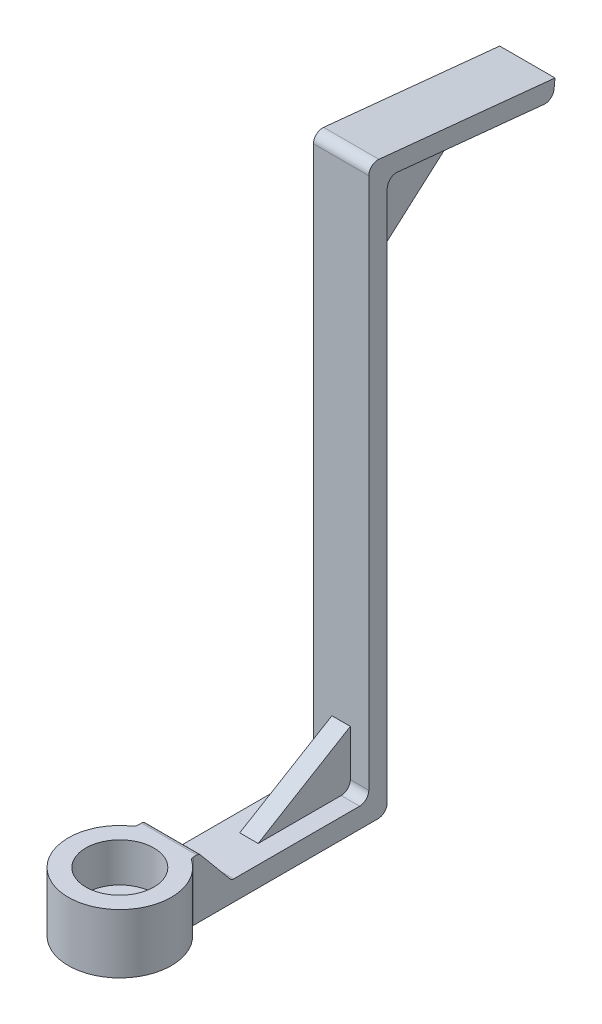
from build123d import *

# Parameters (mm, degrees)
SKETCH1_R                  = 2.794
SKETCH1_R_2                = 1.8415
BOSS_EXTRUDE1_DEPTH        = 3.2131
BOSS_EXTRUDE2_DEPTH        = 1.0922
M1_6_CLEARANCE_HOLE1_D     = 1.8
M1_6_CLEARANCE_HOLE1_DEPTH = 7.25
M1_6_CLEARANCE_HOLE1_TIP   = 0.540774557
SKETCH4_R                  = 1.651
CUT_EXTRUDE2_DEPTH         = 0.127
SKETCH5_W                  = 3
SKETCH5_H                  = 1
BOSS_EXTRUDE3_DEPTH        = 30
BOSS_EXTRUDE4_DEPTH        = 3
FILLET1_R                  = 0.5
RIB1_START                 = -0.5
RIB1_DEPTH                 = 1
RIB3_START                 = -0.5
RIB3_DEPTH                 = 1
BOSS_EXTRUDE8_DEPTH        = 1.5
FILLET2_R                  = 0.25


# Read off the part's stored shape, not the designer's step: Rib1, Rib3
with BuildPart() as part:
    # Sketch1 → Boss-Extrude1 (new body)
    with BuildSketch(Plane(origin=(0, 0, 0), x_dir=(1, 0, 0), z_dir=(0, 1, 0))):
        with Locations(Location((0, 0, 0), (0, 0, 270))):
            Circle(SKETCH1_R)
        with Locations(Location((0, 0, 0), (0, 0, 270))):
            Circle(SKETCH1_R_2, mode=Mode.SUBTRACT)
    extrude(amount=BOSS_EXTRUDE1_DEPTH)

    # Sketch2 → Boss-Extrude2 (add)
    with BuildSketch(Plane(origin=(0, 0, 0), x_dir=(1, 0, 0), z_dir=(0, 1, 0))):
        with BuildLine():
            Line((-1.5, 6.604), (-1.5, 2.357209367))
            ThreePointArc((-1.5, 2.357209367), (0, -2.794), (1.5, 2.357209367))
            Line((1.5, 2.357209367), (1.5, 6.604))
            Line((1.5, 6.604), (1.5, 13))
            Line((1.5, 13), (-1.5, 13))
            Line((-1.5, 13), (-1.5, 6.604))
        make_face()
    extrude(amount=BOSS_EXTRUDE2_DEPTH)

    # M1.6 Clearance Hole1
    with Locations(Plane(origin=(0, 1.0922, 0), x_dir=(1, 0, 0), z_dir=(0, 1, 0))):
        with Locations((0, 0)):
            Hole(M1_6_CLEARANCE_HOLE1_D / 2, depth=M1_6_CLEARANCE_HOLE1_DEPTH)
            with Locations((0, 0, -(M1_6_CLEARANCE_HOLE1_DEPTH + M1_6_CLEARANCE_HOLE1_TIP / 2))):  # 118° drill point
                Cone(0, M1_6_CLEARANCE_HOLE1_D / 2, M1_6_CLEARANCE_HOLE1_TIP, mode=Mode.SUBTRACT)

    # Sketch4 → Cut-Extrude2 (cut)
    with BuildSketch(Plane.XZ):
        with Locations(Location((0, 0, 0), (0, 0, 270))):
            Circle(SKETCH4_R)
    extrude(amount=-CUT_EXTRUDE2_DEPTH, mode=Mode.SUBTRACT)

    # Sketch5 → Boss-Extrude3 (add)
    with BuildSketch(Plane.XZ):
        with Locations((0, -12.5)):
            Rectangle(SKETCH5_W, SKETCH5_H)
    extrude(amount=-BOSS_EXTRUDE3_DEPTH)

    # Sketch6 → Boss-Extrude4 (add)
    with BuildSketch(Plane(origin=(1.5, 0, 0), x_dir=(0, 0, -1), z_dir=(1, 0, 0))):
        Polygon((22, 29), (12, 30), (12, 31.004987562), (22.099503719, 29.99503719), align=None)
    extrude(amount=-BOSS_EXTRUDE4_DEPTH)

    # Fillet1
    fillet1_edges = [part.edges().sort_by_distance(p)[0] for p in [
        (0, 0, -13),
        (0, 1.0922, -12),
        (0, 29, -22),
        (0, 31.004987562, -12),
        (0, 29.9, -13),
    ]]
    fillet(fillet1_edges, radius=FILLET1_R)

    # Rib1 outline → Rib1 (add)
    with BuildSketch(Plane(origin=(0, 0, 0), x_dir=(0, 0, -1), z_dir=(1, 0, 0)).offset(RIB1_START)):
        with BuildLine():
            Line((12, 1.5922), (12, 4.0922))
            Line((12, 4.0922), (7, 1.0922))
            Line((7, 1.0922), (11.5, 1.0922))
            ThreePointArc((11.5, 1.0922), (11.853553391, 1.238646609), (12, 1.5922))
        make_face()
    extrude(amount=RIB1_DEPTH)

    # Rib3 outline → Rib3 (add)
    with BuildSketch(Plane(origin=(0, 0, 0), x_dir=(0, 0, -1), z_dir=(1, 0, 0)).offset(RIB3_START)):
        with BuildLine():
            Line((13, 24.99503719), (18, 29.4))
            Line((18, 29.4), (13.54975186, 29.845024814))
            ThreePointArc((13.54975186, 29.845024814), (13.16449734, 29.718232486), (13, 29.347506219))
            Line((13, 29.347506219), (13, 24.99503719))
        make_face()
    extrude(amount=RIB3_DEPTH)

    # Sketch11 → Boss-Extrude8 (add, symmetric)
    with BuildSketch(Plane(origin=(0, 0, 0), x_dir=(0, 0, -1), z_dir=(1, 0, 0))):
        Polygon((2.357209367, 1.0922), (4.557209367, 1.0922), (2.794, 3.2131), (2.357209367, 3.2131), align=None)
    extrude(amount=BOSS_EXTRUDE8_DEPTH, both=True)

    # Fillet2
    fillet2_edges = [part.edges().sort_by_distance(p)[0] for p in [
        (-1.5, 1.60655, -2.357209367),
        (1.5, 1.60655, -2.357209367),
        (0, 3.2131, -2.794),
        (0, 1.0922, -4.557209367),
    ]]
    fillet(fillet2_edges, radius=FILLET2_R)


solid = part.part
